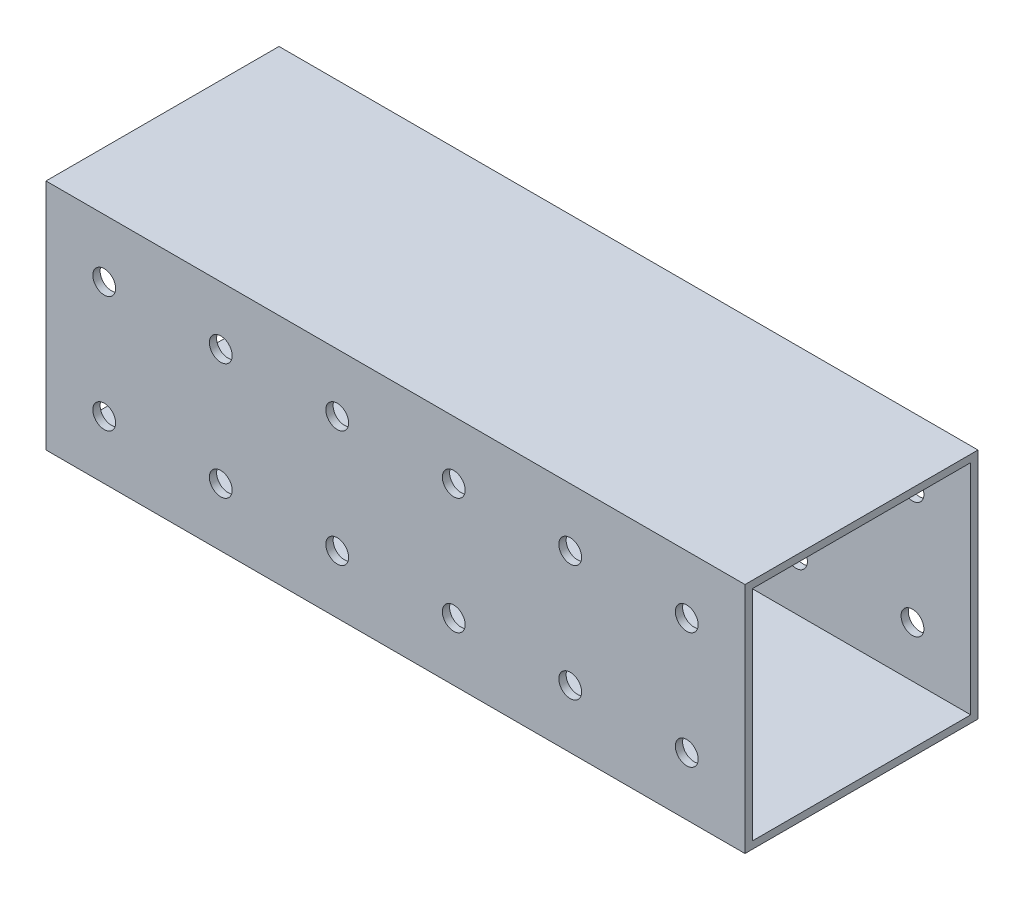
from build123d import *

# Parameters (mm, degrees)
SKETCH1_W           = 50.8
SKETCH1_H           = 50.8
BOSS_EXTRUDE1_DEPTH = 152.4
SHELL1_T            = -1.5875
SKETCH2_R           = 2.4892
CUT_EXTRUDE1_DEPTH  = 169.48453935
LPATTERN1_COUNT     = 6
LPATTERN1_PITCH     = 25.4


with BuildPart() as part:
    # Sketch1 → Boss-Extrude1 (new body)
    with BuildSketch(Plane(origin=(0, 0, 0), x_dir=(0, 0, -1), z_dir=(1, 0, 0))):
        with Locations((25.4, 25.4)):
            Rectangle(SKETCH1_W, SKETCH1_H)
    extrude(amount=BOSS_EXTRUDE1_DEPTH)

    # Shell1
    shell1_openings = [part.faces().sort_by_distance(p)[0] for p in [
        (0, 25.4, -25.4),
        (152.4, 25.4, -25.4),
    ]]
    offset(amount=SHELL1_T, openings=shell1_openings, kind=Kind.INTERSECTION)

    # Sketch2 → Cut-Extrude1 (cut, through all)
    with BuildSketch(Plane(origin=(0, 0, -50.8), x_dir=(-1, 0, 0), z_dir=(0, 0, -1))):
        with Locations((-12.7, 12.7)):
            Circle(SKETCH2_R)
        with Locations((-12.7, 38.1)):
            Circle(SKETCH2_R)
    cut_extrude1 = extrude(amount=-CUT_EXTRUDE1_DEPTH, mode=Mode.SUBTRACT)

    # LPattern1: Cut-Extrude1 ×6
    with Locations(*[(i * LPATTERN1_PITCH, 0, 0) for i in range(1, LPATTERN1_COUNT)]):
        add(cut_extrude1, mode=Mode.SUBTRACT)


solid = part.part
